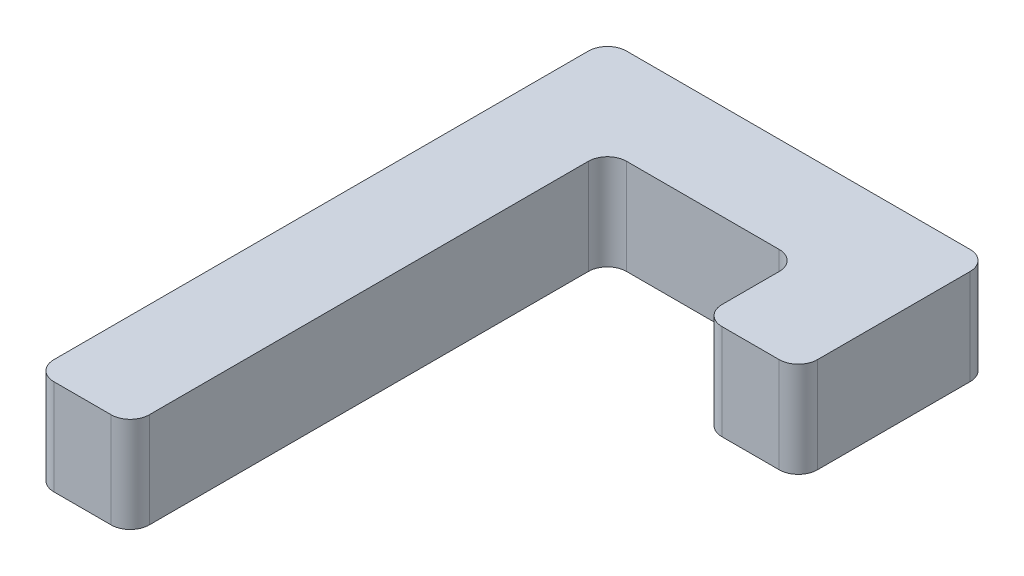
from build123d import *

# Parameters (mm, degrees)
BOSS_EXTRUDE1_DEPTH = 12.7
FILLET1_R           = 2.54


with BuildPart() as part:
    # Sketch1 → Boss-Extrude1 (new body)
    with BuildSketch(Plane(origin=(0, 0, 0), x_dir=(1, 0, 0), z_dir=(0, 1, 0))):
        Polygon((0, 0), (0, 76.2), (50.8, 76.2), (50.8, 50.8), (38.1, 50.8), (38.1, 63.5), (12.7, 63.5), (12.7, 0), align=None)
    extrude(amount=BOSS_EXTRUDE1_DEPTH)

    # Fillet1
    fillet1_edges = [part.edges().sort_by_distance(p)[0] for p in [
        (50.8, 6.35, -76.2),
        (38.1, 6.35, -63.5),
        (50.8, 6.35, -50.8),
        (38.1, 6.35, -50.8),
        (12.7, 6.35, 0),
        (0, 6.35, 0),
        (12.7, 6.35, -63.5),
        (0, 6.35, -76.2),
    ]]
    fillet(fillet1_edges, radius=FILLET1_R)


solid = part.part
